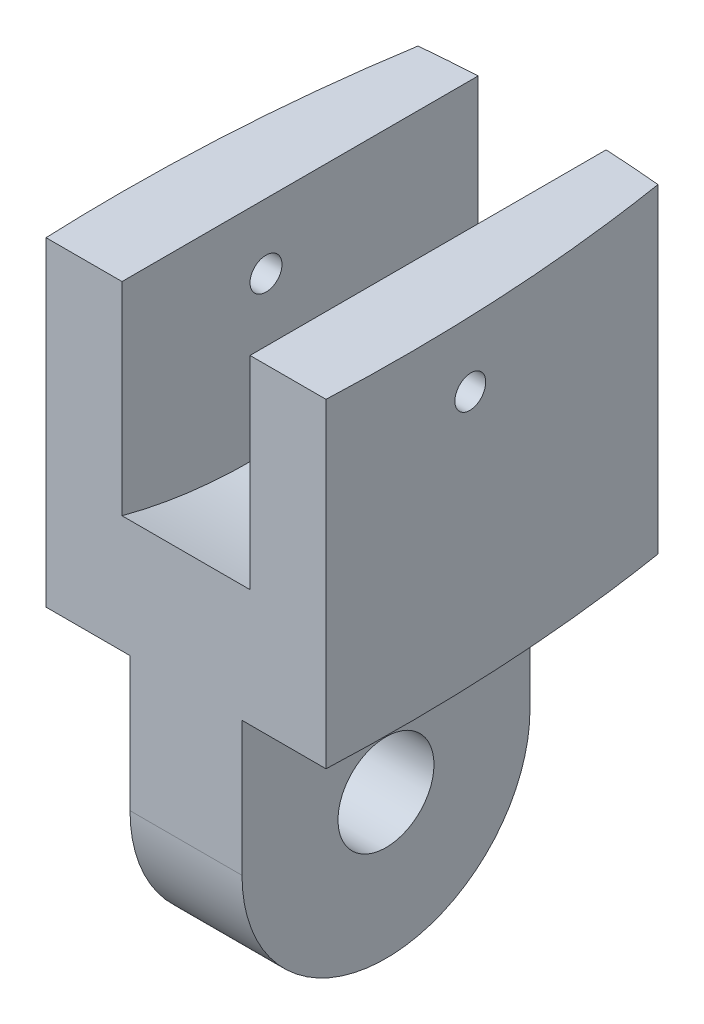
from build123d import *

# Parameters (mm, degrees)
LOFT_START                = -20
LOFT_2_DEPTH              = 20
SLOT_BOSS_EXTRUDE_DEPTH   = 3.5
NOTCH_CUT_EXTRUDE_DEPTH   = 4
F_6_0MM_DOWEL_HOLE1_D     = 6
CUT_EXTRUDE1_DEPTH        = 41.209626458
CUT_EXTRUDE1_DEPTH_BACK   = 41.209626458
F_2MM_DOWEL_HOLE_SKETCH_R = 1


# Read off the part's stored shape, not the designer's step: Loft
with BuildPart() as part:
    # Loft 2 outline → Loft 2 (new body)
    with BuildSketch(Plane(origin=(0, 0, 0), x_dir=(1.0, -2.490035096657917e-12, 0), z_dir=(2.490035096657917e-12, 1.0, -1.6178493389115347e-12)).offset(LOFT_START)):
        with BuildLine():
            add(Edge.make_bspline(
                [(-7.500000006, 10.153846153), (-6.876918809, 10.213864714), (-5.629329261, 10.319078273), (-3.754701534, 10.432067478), (-1.877896778, 10.499966465), (-0.625965179, 10.515066492), (0.625965179, 10.515066492), (1.877896376, 10.499966465), (3.754699934, 10.432067556), (5.629330497, 10.319078204), (6.876918808, 10.213864714), (7.5, 10.153846153)],
                knots=[0.804050837, 0.804050837, 0.804050837, 0.804050837, 0.828544483, 0.853038128, 0.877531773, 0.902025419, 0.902025419, 0.926519064, 0.951012709, 0.975506355, 1, 1, 1, 1], degree=3))
            add(Edge.make_bspline(
                [(-8.749999999, -11.846153861), (-8.82839887, -9.962671759), (-8.893913844, -6.220781941), (-8.718337998, -0.683170366), (-8.268913846, 4.779218054), (-7.786732208, 8.370661565), (-7.500000006, 10.153846153)],
                knots=[0.516152852, 0.516152852, 0.516152852, 0.516152852, 0.588127348, 0.660101844, 0.732076341, 0.804050837, 0.804050837, 0.804050837, 0.804050837], degree=3))
            Line((-8.749999999, -11.846153861), (8.75, -11.846153846))
            add(Edge.make_bspline(
                [(7.5, 10.153846153), (7.786732204, 8.370661588), (8.268913844, 4.779218073), (8.718337998, -0.683170354), (8.893913844, -6.220781934), (8.82839887, -9.962671757), (8.75, -11.846153846)],
                knots=[0, 0, 0, 0, 0.071974497, 0.143948993, 0.21592349, 0.287897986, 0.287897986, 0.287897986, 0.287897986], degree=3))
        make_face()
    extrude(amount=LOFT_2_DEPTH)

    # Slot Sketch → Slot Boss-Extrude (add, symmetric)
    with BuildSketch(Plane(origin=(0, 0, 0), x_dir=(0, 0, -1), z_dir=(1, 0, 0))):
        with BuildLine():
            Line((-11.846153846, -28.391743615), (-11.846153846, -12.033776613))
            ThreePointArc((-11.846153846, -12.033776613), (-2.846153846, -3.033776613), (6.153846154, -12.033776613))
            Line((6.153846154, -12.033776613), (6.153846154, -28.391743615))
            ThreePointArc((6.153846154, -28.391743615), (-2.846153846, -37.391743615), (-11.846153846, -28.391743615))
        make_face()
    extrude(amount=SLOT_BOSS_EXTRUDE_DEPTH, both=True)

    # Notch Sketch → Notch Cut-Extrude (cut, symmetric)
    with BuildSketch(Plane(origin=(0, 0, 0), x_dir=(0, 0, -1), z_dir=(1, 0, 0))):
        with BuildLine():
            Line((-15.97451802, -11.299393728), (-15.524991842, 1.708253078))
            Line((-15.524991842, 1.708253078), (11.860726968, 1.708253078))
            Line((11.860726968, 1.708253078), (11.18600525, -10.073329121))
            add(Edge.make_bspline(
                [(-15.97451802, -11.299393728), (-2.356980938, -16.766629454), (11.18600525, -10.073329121)],
                knots=[0, 0, 0, 1, 1, 1], degree=2))
        make_face()
    extrude(amount=NOTCH_CUT_EXTRUDE_DEPTH, both=True, mode=Mode.SUBTRACT)

    # Ø6.0mm Dowel Hole1 (through all)
    with Locations(Plane(origin=(3.5, 0, 0), x_dir=(0, 0, -1), z_dir=(1, 0, 0))):
        with Locations((-2.846153846, -28.391743615)):
            Hole(F_6_0MM_DOWEL_HOLE1_D / 2)

    # 2mm Dowel Hole Sketch → Cut-Extrude1 (cut, two sides: drawn at the far end of the back side and taken through both)
    with BuildSketch(Plane(origin=(0, 0, 0), x_dir=(0, 0, -1), z_dir=(1, 0, 0)).offset(-CUT_EXTRUDE1_DEPTH_BACK)):
        with Locations((-2.846153846, -4.070213016)):
            Circle(F_2MM_DOWEL_HOLE_SKETCH_R)
    extrude(amount=CUT_EXTRUDE1_DEPTH + CUT_EXTRUDE1_DEPTH_BACK, mode=Mode.SUBTRACT)


solid = part.part
